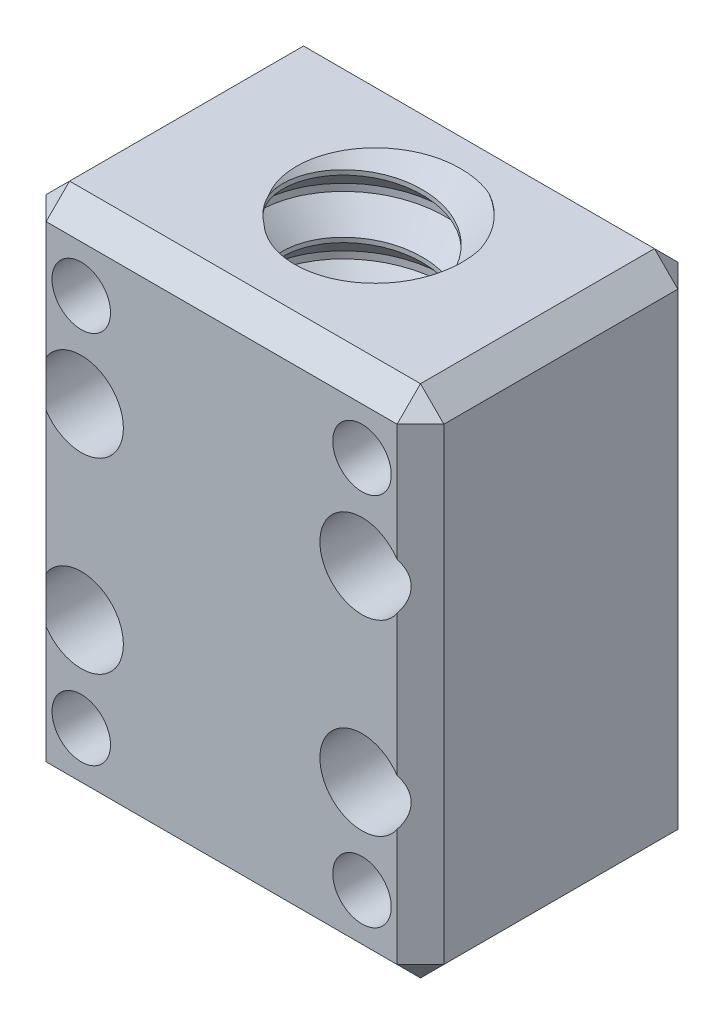
from build123d import *

# Parameters (mm, degrees)
SKETCH_1_W          = 17
SKETCH_1_H          = 22
EXTRUDE_1_DEPTH     = 12
CUT_EXTRUDE_1_REACH = 28.462
SKETCH_2_R          = 4
SWEEP_1_PITCH       = 2.5
SKETCH_7_R          = 15.483933968
CUT_EXTRUDE_3_DEPTH = 30
SKETCH_8_R          = 1.1
CUT_EXTRUDE_4_DEPTH = 19.364547541
SKETCH_9_R          = 1.8
CUT_EXTRUDE_5_DEPTH = 7
SKETCH_10_R         = 1.25
CUT_EXTRUDE_6_DEPTH = 7


with BuildPart() as part:
    # 草图1 → 凸台-拉伸1 (new body)
    with BuildSketch(Plane.XY):
        Rectangle(SKETCH_1_W, SKETCH_1_H)
    extrude(amount=EXTRUDE_1_DEPTH)

    # 草图2 → 切除-拉伸1 (cut, up to next)
    with BuildSketch(Plane.XZ.offset(11), mode=Mode.PRIVATE) as cut_extrude_1_sk1:
        with Locations(Location((0, 6, 0), (0, 0, 270))):
            Circle(SKETCH_2_R)
    cut_extrude_1_tool1 = extrude(cut_extrude_1_sk1.sketch, amount=-CUT_EXTRUDE_1_REACH, mode=Mode.PRIVATE) & part.part
    add(cut_extrude_1_tool1.solids().sort_by_distance((0, -11, 6))[0], mode=Mode.SUBTRACT)

    # 扫描1: the profile of 草图6 profile screwed along a right-hand helix of 9 turns, 10 arcs to a turn; built about Z, then put on its axis
    sweep_1_z = Axis((0, 0, 0), (0, 0, 1))
    sweep_1_corners = [(4.0003, 0, 2.2003), (4.0003, 0, -0.0003), (3, 0, 1), (3, 0, 1.2)]
    with BuildLine(mode=Mode.PRIVATE) as sweep_1_profile:
        Line(sweep_1_corners[0], sweep_1_corners[1])
        Line(sweep_1_corners[1], sweep_1_corners[2])
        Line(sweep_1_corners[2], sweep_1_corners[3])
        Line(sweep_1_corners[3], sweep_1_corners[0])
    sweep_1_cap = Face(sweep_1_profile.wire())
    sweep_1_turn_angles = [0, 18, 36, 54, 72, 90, 108, 126, 144, 162, 180, 198, 216, 234, 252, 270, 288, 306, 324, 342, 360]
    sweep_1_turn_weights = [1, 0.9510565162951535, 1, 0.9510565162951535, 1, 0.9510565162951535, 1, 0.9510565162951535, 1, 0.9510565162951535, 1, 0.9510565162951535, 1, 0.9510565162951535, 1, 0.9510565162951535, 1, 0.9510565162951535, 1, 0.9510565162951535, 1]
    sweep_1_turn_rails = [Edge.make_bspline([Vector(p[0], p[1], 0).rotate(sweep_1_z, sweep_1_turn_angles[k]) / sweep_1_turn_weights[k] + Vector(0, 0, p[2] + SWEEP_1_PITCH * sweep_1_turn_angles[k] / 360) for k in range(21)], [0, 0, 0, 1, 1, 2, 2, 3, 3, 4, 4, 5, 5, 6, 6, 7, 7, 8, 8, 9, 9, 10, 10, 10], 2, sweep_1_turn_weights) for p in sweep_1_corners]
    sweep_1_turn_sides = [Face.make_surface_from_curves(sweep_1_turn_rails[p[0]], sweep_1_turn_rails[p[1]]) for p in [(0, 1), (1, 2), (2, 3), (3, 0)]]
    sweep_1 = Plane(origin=(0, -11, 6), x_dir=(0, 0, -1), z_dir=(0, 1, 0)) * Solid(Shell([*[p.moved(Location((0, 0, SWEEP_1_PITCH * i))) for i in range(9) for p in sweep_1_turn_sides], sweep_1_cap, sweep_1_cap.rotate(sweep_1_z, 3240).moved(Location((0, 0, SWEEP_1_PITCH * 3240 / 360)))]))
    add(sweep_1)

    # 草图7 → 切除-拉伸3 (cut)
    with BuildSketch(Plane(origin=(0, 11, 0), x_dir=(1, 0, 0), z_dir=(0, 1, 0))):
        with Locations((0, -6)):
            Circle(SKETCH_7_R)
    extrude(amount=CUT_EXTRUDE_3_DEPTH, mode=Mode.SUBTRACT)

    # 草图8 → 切除-拉伸4 (cut, through all)
    with BuildSketch(Plane.XY.offset(12)):
        with Locations((6, 4)):
            Circle(SKETCH_8_R)
        with Locations(Location((-6, 4, 0), (0, 0, 180))):
            Circle(SKETCH_8_R)
        with Locations((-6, -4)):
            Circle(SKETCH_8_R)
        with Locations(Location((6, -4, 0), (0, 0, 180))):
            Circle(SKETCH_8_R)
    extrude(amount=-CUT_EXTRUDE_4_DEPTH, mode=Mode.SUBTRACT)

    # 草图9 → 切除-拉伸5 (cut)
    with BuildSketch(Plane.XY.offset(12)):
        with Locations((-6, 4)):
            Circle(SKETCH_9_R)
        with Locations((6, 4)):
            Circle(SKETCH_9_R)
        with Locations((6, -4)):
            Circle(SKETCH_9_R)
        with Locations((-6, -4)):
            Circle(SKETCH_9_R)
    extrude(amount=-CUT_EXTRUDE_5_DEPTH, mode=Mode.SUBTRACT)

    # 草图10 → 切除-拉伸6 (cut)
    with BuildSketch(Plane.XY.offset(12)):
        with Locations((6, 8)):
            Circle(SKETCH_10_R)
        with Locations(Location((-6, 8, 0), (0, 0, 180))):
            Circle(SKETCH_10_R)
        with Locations(Location((6, -8, 0), (0, 0, 180))):
            Circle(SKETCH_10_R)
        with Locations((-6, -8)):
            Circle(SKETCH_10_R)
    extrude(amount=-CUT_EXTRUDE_6_DEPTH, mode=Mode.SUBTRACT)

    # Chamfer 1
    # the kernel refuses this chamfer: 1 mm, written as the material it takes off along each edge
    with BuildSketch(Plane(origin=(-7.833333333, 10.333333333, 11.333333333), x_dir=(-0.7071067811865475, -0.7071067811865475, 0), z_dir=(-0.5773502691896258, 0.5773502691896258, 0.5773502691896258)), Plane(origin=(7.833333333, 10.333333333, 11.333333333), x_dir=(0, -0.7071067811865475, 0.7071067811865475), z_dir=(0.5773502691896258, 0.5773502691896258, 0.5773502691896258)), Plane(origin=(-7.833333333, -10.333333333, 0.666666667), x_dir=(-0.7071067811865475, 0.7071067811865475, 0), z_dir=(-0.5773502691896257, -0.5773502691896257, -0.5773502691896258)), Plane(origin=(7.833333333, -10.333333333, 0.666666667), x_dir=(0, 0.7071067811865476, -0.7071067811865475), z_dir=(0.5773502691896257, -0.5773502691896257, -0.5773502691896258))) as chamfer_1_piece_1:
        Polygon((-0.707106781, -0.40824829), (0.707106781, -0.40824829), (0, 0.816496581), align=None)
    extrude(amount=1.270170592, mode=Mode.SUBTRACT)
    with BuildSketch(Plane(origin=(-7.833333333, -10.333333333, 11.333333333), x_dir=(-0.7071067811865475, 0.7071067811865475, 0), z_dir=(-0.5773502691896258, -0.5773502691896258, 0.5773502691896258)), Plane(origin=(7.833333333, -10.333333333, 11.333333333), x_dir=(0, 0.7071067811865475, 0.7071067811865475), z_dir=(0.5773502691896258, -0.5773502691896258, 0.5773502691896258)), Plane(origin=(-7.833333333, 10.333333333, 0.666666667), x_dir=(-0.7071067811865475, -0.7071067811865475, 0), z_dir=(-0.5773502691896257, 0.5773502691896257, -0.5773502691896258)), Plane(origin=(7.833333333, 10.333333333, 0.666666667), x_dir=(0, -0.7071067811865476, -0.7071067811865475), z_dir=(0.5773502691896257, 0.5773502691896257, -0.5773502691896258))) as chamfer_1_piece_2:
        Polygon((-0.707106781, 0.40824829), (0.707106781, 0.40824829), (0, -0.816496581), align=None)
    extrude(amount=1.270170592, mode=Mode.SUBTRACT)
    with BuildSketch(Plane(origin=(-8.5, 13.571682988, 12), x_dir=(-0.027495876610585647, 0, -0.9996219169112968), z_dir=(0, -1, 0)), Plane(origin=(8.5, -13.571682988, 0), x_dir=(-0.9996219169112968, 0, -0.027495876610586365), z_dir=(0, 1, 0))) as chamfer_1_piece_3:
        with BuildLine():
            Line((1.028673195, 0), (-0.056547155, 1.027117794))
            Line((-0.056547155, 1.027117794), (-0.076539593, 1.026567876))
            ThreePointArc((-0.076539593, 1.026567876), (-0.034129227, 0.51339783), (-0.019992438, -0.000549918))
            Line((-0.019992438, -0.000549918), (0.000549918, -0.019992438))
            ThreePointArc((0.000549918, -0.019992438), (0.514497665, -0.00585565), (1.029223113, -0.019992438))
            Line((1.029223113, -0.019992438), (1.028673195, 0))
        make_face()
    extrude(amount=27.143365976, mode=Mode.SUBTRACT)
    with BuildSketch(Plane(origin=(-11.071682988, -11, 12), x_dir=(0, -0.027495876610585647, -0.9996219169112968), z_dir=(1, 0, 0)), Plane(origin=(11.071682988, 11, 0), x_dir=(0, -0.9996219169112968, -0.02749587661058639), z_dir=(-1, 0, 0))) as chamfer_1_piece_4:
        with BuildLine():
            Line((1.028673195, 0), (-0.056547155, 1.027117794))
            Line((-0.056547155, 1.027117794), (-0.076539593, 1.026567876))
            ThreePointArc((-0.076539593, 1.026567876), (-0.034129227, 0.51339783), (-0.019992438, -0.000549918))
            Line((-0.019992438, -0.000549918), (0.000549918, -0.019992438))
            ThreePointArc((0.000549918, -0.019992438), (0.514497665, -0.00585565), (1.029223113, -0.019992438))
            Line((1.029223113, -0.019992438), (1.028673195, 0))
        make_face()
    extrude(amount=22.143365976, mode=Mode.SUBTRACT)
    with BuildSketch(Plane(origin=(8.5, -13.571682988, 12), x_dir=(-0.9996219169112968, 0, 0.027495876610585623), z_dir=(0, 1, 0)), Plane(origin=(-8.5, 13.571682988, 0), x_dir=(-0.02749587661058563, 0, 0.9996219169112968), z_dir=(0, -1, 0))) as chamfer_1_piece_5:
        with BuildLine():
            Line((1.028673195, 0), (-0.056547155, -1.027117794))
            Line((-0.056547155, -1.027117794), (-0.076539593, -1.026567876))
            ThreePointArc((-0.076539593, -1.026567876), (-0.034129227, -0.51339783), (-0.019992438, 0.000549918))
            Line((-0.019992438, 0.000549918), (0.000549918, 0.019992438))
            ThreePointArc((0.000549918, 0.019992438), (0.514497665, 0.00585565), (1.029223113, 0.019992438))
            Line((1.029223113, 0.019992438), (1.028673195, 0))
        make_face()
    extrude(amount=27.143365976, mode=Mode.SUBTRACT)
    with BuildSketch(Plane(origin=(-11.071682988, -11, 0), x_dir=(0, -0.02749587661058563, 0.9996219169112968), z_dir=(1, 0, 0)), Plane(origin=(11.071682988, 11, 12), x_dir=(0, -0.9996219169112968, 0.027495876610585647), z_dir=(-1, 0, 0))) as chamfer_1_piece_6:
        with BuildLine():
            Line((1.028673195, 0), (-0.056547155, -1.027117794))
            Line((-0.056547155, -1.027117794), (-0.076539593, -1.026567876))
            ThreePointArc((-0.076539593, -1.026567876), (-0.034129227, -0.51339783), (-0.019992438, 0.000549918))
            Line((-0.019992438, 0.000549918), (0.000549918, 0.019992438))
            ThreePointArc((0.000549918, 0.019992438), (0.514497665, 0.00585565), (1.029223113, 0.019992438))
            Line((1.029223113, 0.019992438), (1.028673195, 0))
        make_face()
    extrude(amount=22.143365976, mode=Mode.SUBTRACT)
    with BuildSketch(Plane(origin=(8.5, -11, -2.571682988), x_dir=(-0.9996219169112968, -0.027495876610585623, 0), z_dir=(0, 0, 1)), Plane(origin=(8.5, 11, -2.571682988), x_dir=(0.027495876610585647, -0.9996219169112968, 0), z_dir=(0, 0, 1))) as chamfer_1_piece_7:
        with BuildLine():
            Line((1.028673195, 0), (-0.056547155, -1.027117794))
            Line((-0.056547155, -1.027117794), (-0.076539593, -1.026567876))
            ThreePointArc((-0.076539593, -1.026567876), (-0.034129227, -0.51339783), (-0.019992438, 0.000549918))
            Line((-0.019992438, 0.000549918), (0.000549918, 0.019992438))
            ThreePointArc((0.000549918, 0.019992438), (0.514497665, 0.00585565), (1.029223113, 0.019992438))
            Line((1.029223113, 0.019992438), (1.028673195, 0))
        make_face()
    extrude(amount=17.143365976, mode=Mode.SUBTRACT)
    with BuildSketch(Plane(origin=(-8.5, -11, -2.571682988), x_dir=(0.9996219169112968, -0.027495876610585623, 0), z_dir=(0, 0, 1)), Plane(origin=(-8.5, 11, -2.571682988), x_dir=(-0.027495876610585647, -0.9996219169112968, 0), z_dir=(0, 0, 1))) as chamfer_1_piece_8:
        with BuildLine():
            Line((1.028673195, 0), (-0.056547155, 1.027117794))
            Line((-0.056547155, 1.027117794), (-0.076539593, 1.026567876))
            ThreePointArc((-0.076539593, 1.026567876), (-0.034129227, 0.51339783), (-0.019992438, -0.000549918))
            Line((-0.019992438, -0.000549918), (0.000549918, -0.019992438))
            ThreePointArc((0.000549918, -0.019992438), (0.514497665, -0.00585565), (1.029223113, -0.019992438))
            Line((1.029223113, -0.019992438), (1.028673195, 0))
        make_face()
    extrude(amount=17.143365976, mode=Mode.SUBTRACT)


solid = part.part
